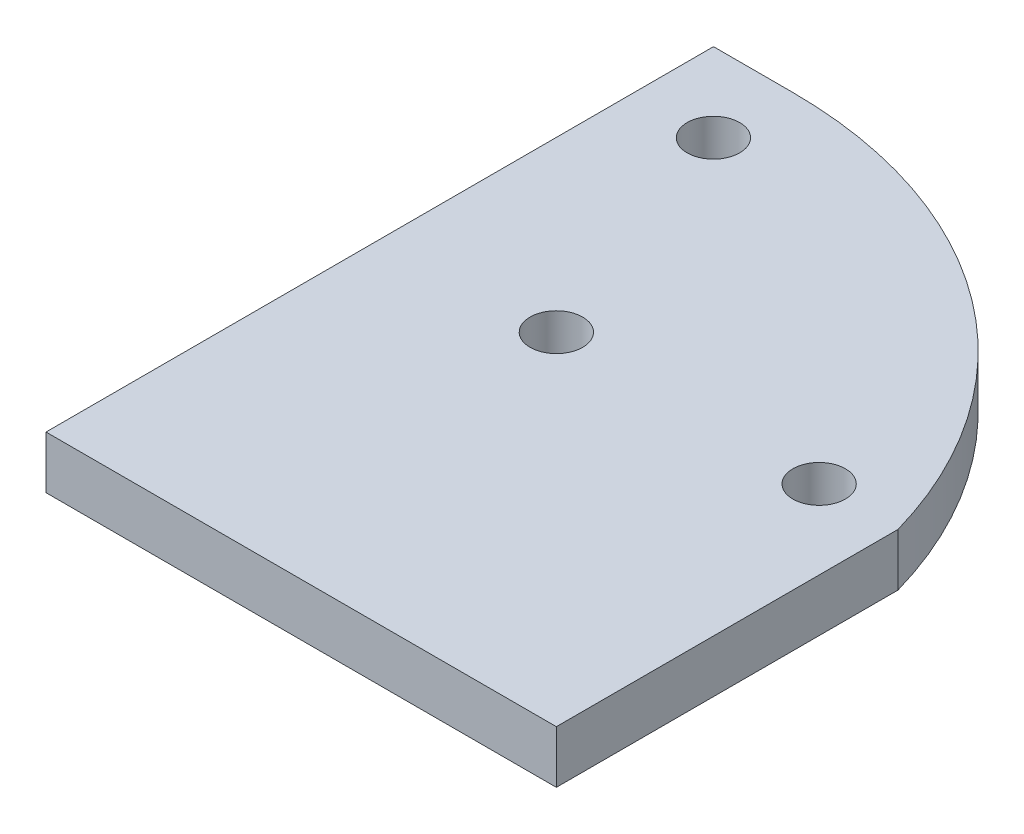
from build123d import *

# Parameters (mm, degrees)
BOSS_EXTRUDE1_DEPTH     = 10
CUT_EXTRUDE4_DEPTH      = 161.179305779
CUT_EXTRUDE4_DEPTH_BACK = 161.179305779
SKETCH2_R               = 5


with BuildPart() as part:
    # Sketch1 → Boss-Extrude1 (new body)
    with BuildSketch(Plane(origin=(0, 0, 0), x_dir=(1, 0, 0), z_dir=(0, 1, 0))):
        with BuildLine():
            Line((0, 0), (0, 127))
            Line((0, 127), (15, 127))
            ThreePointArc((15, 127), (66.440280909, 109.758742946), (97.1, 65))
            Line((97.1, 65), (97.1, 0))
            Line((97.1, 0), (0, 0))
        make_face()
    extrude(amount=BOSS_EXTRUDE1_DEPTH)

    # Sketch2 → Cut-Extrude4 (cut, two sides: drawn at the far end of the back side and taken through both)
    with BuildSketch(Plane(origin=(0, 0, 0), x_dir=(1, 0, 0), z_dir=(0, 1, 0)).offset(-CUT_EXTRUDE4_DEPTH_BACK)):
        with Locations((14.998992834, 111.984631039)):
            Circle(SKETCH2_R)
        with Locations((82.1, 65)):
            Circle(SKETCH2_R)
        with Locations((32.1, 65)):
            Circle(SKETCH2_R)
    extrude(amount=CUT_EXTRUDE4_DEPTH + CUT_EXTRUDE4_DEPTH_BACK, mode=Mode.SUBTRACT)


solid = part.part
